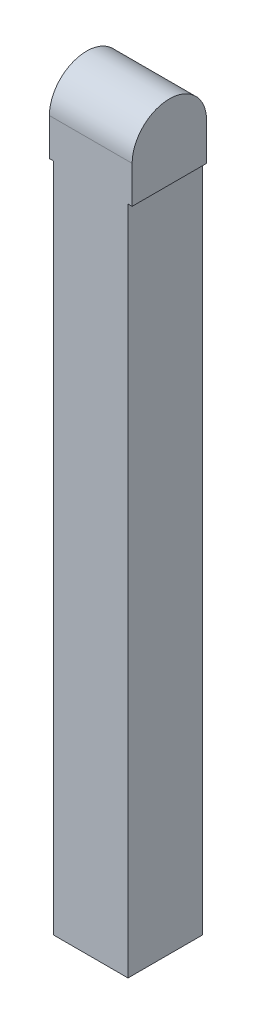
from build123d import *

# Parameters (mm, degrees)
SKETCH_1_W          = 18
SKETCH_1_H          = 18
EXTRUDE_1_DEPTH     = 160
SKETCH_2_W          = 18
SKETCH_2_H          = 18
EXTRUDE_2_DEPTH     = 2
SKETCH_3_W          = 20
SKETCH_3_H          = 18
EXTRUDE_4_DEPTH     = 18
CUT_EXTRUDE_1_DEPTH = 182.331188713


with BuildPart() as part:
    # 草图1 → 凸台-拉伸1 (new body)
    with BuildSketch(Plane(origin=(0, 0, 0), x_dir=(1, 0, 0), z_dir=(0, 1, 0))):
        Rectangle(SKETCH_1_W, SKETCH_1_H)
    extrude(amount=EXTRUDE_1_DEPTH)

    # 草图2 → 凸台-拉伸2 (add)
    with BuildSketch(Plane(origin=(0, 160, 0), x_dir=(1, 0, 0), z_dir=(0, 1, 0))):
        Rectangle(SKETCH_2_W, SKETCH_2_H)
    extrude(amount=EXTRUDE_2_DEPTH)

    # 草图3 → 凸台-拉伸4 (add)
    with BuildSketch(Plane(origin=(0, 162, 0), x_dir=(1, 0, 0), z_dir=(0, 1, 0))):
        Rectangle(SKETCH_3_W, SKETCH_3_H)
    extrude(amount=EXTRUDE_4_DEPTH)

    # 草图4 → 切除-拉伸1 (cut, through all)
    with BuildSketch(Plane.ZY.offset(10)):
        with BuildLine():
            Line((-9, 171), (-9, 185))
            Line((-9, 185), (9, 185))
            Line((9, 185), (9, 171))
            ThreePointArc((9, 171), (0, 180), (-9, 171))
        make_face()
    extrude(amount=-CUT_EXTRUDE_1_DEPTH, mode=Mode.SUBTRACT)


solid = part.part
